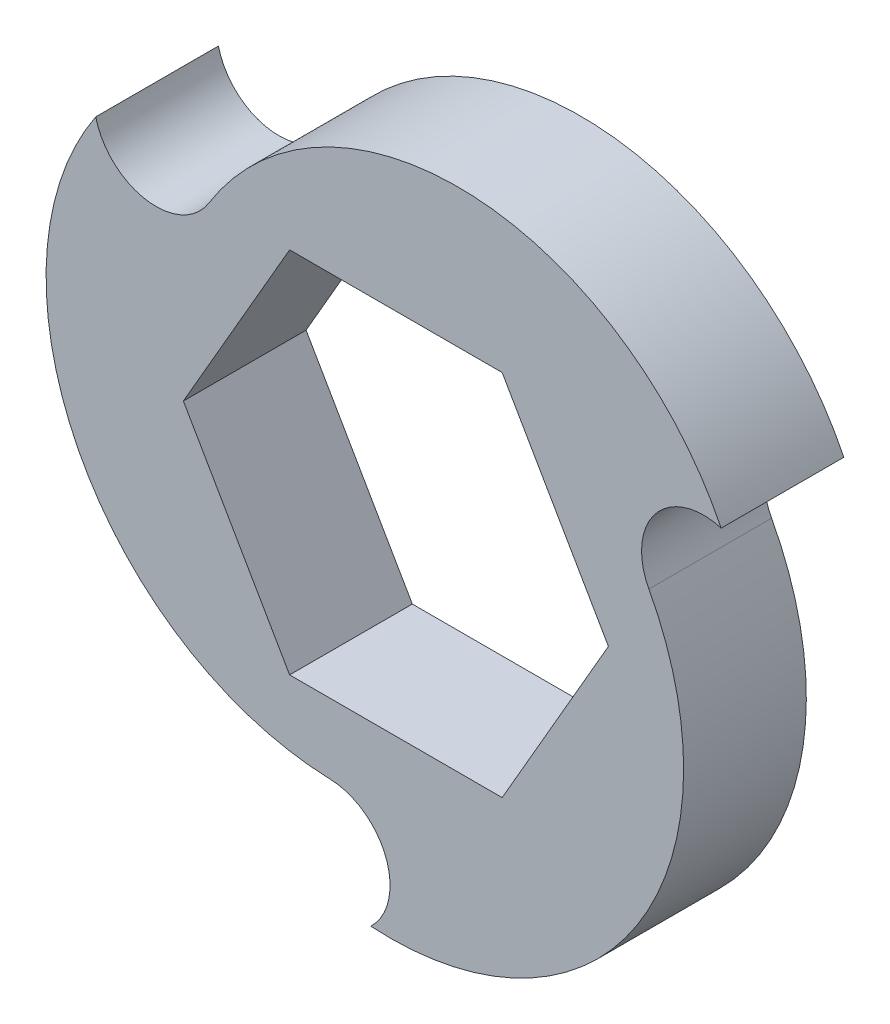
from build123d import *

# Parameters (mm, degrees)
BOSS_EXTRUDE1_DEPTH = 5


with BuildPart() as part:
    # Sketch1 → Boss-Extrude1 (new body)
    with BuildSketch(Plane.XY):
        with BuildLine():
            ThreePointArc((-7.622920409, 7.504174679), (3.119787009, 13.136545802), (13.254385519, 6.471766722))
            ThreePointArc((13.254385519, 6.471766722), (10.577414019, 5.640008716), (10.310266111, 2.849555386))
            ThreePointArc((10.310266111, 2.849555386), (9.816688878, -9.270087705), (-1.022478371, -14.714517932))
            ThreePointArc((-1.022478371, -14.714517932), (-0.404316183, -11.980313605), (-2.687345702, -10.353730065))
            ThreePointArc((-2.687345702, -10.353730065), (-12.936475887, -3.866458096), (-12.231907148, 8.24275121))
            ThreePointArc((-12.231907148, 8.24275121), (-10.173097835, 6.340304888), (-7.622920409, 7.504174679))
        make_face()
        Polygon((8.660254038, 0), (4.330127019, 7.5), (-4.330127019, 7.5), (-8.660254038, 0), (-4.330127019, -7.5), (4.330127019, -7.5), align=None, mode=Mode.SUBTRACT)
    extrude(amount=BOSS_EXTRUDE1_DEPTH)


solid = part.part
